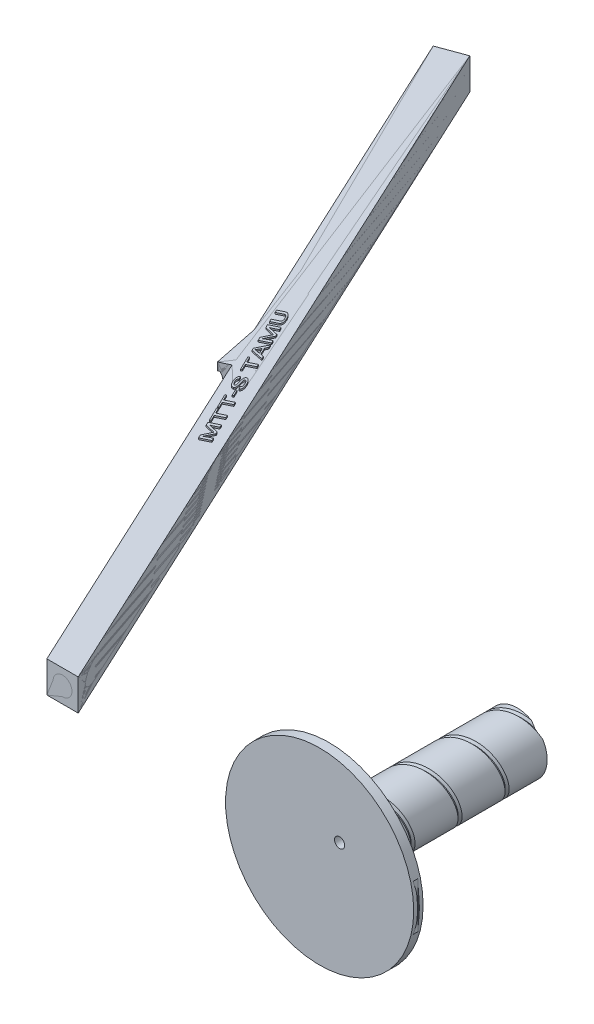
from build123d import *

# Parameters (mm, degrees)
SKETCH8_R            = 9.55
HELICALLENGTH_DEPTH  = 60
WIRETHREADS_PITCH    = 15
SKETCH12_R           = 8
CUT_EXTRUDE1_DEPTH   = 60
SKETCH14_R           = 30
TOP_OF_HELICAL_DEPTH = 3
SUPPORT_DEPTH        = 5
SKETCH18_R           = 1.616087613
SMAHOLE_DEPTH        = 3
CUT_EXTRUDE6_DEPTH   = 15
SKETCH41_R           = 4.64435048
CUT_EXTRUDE7_DEPTH   = 15
CUT_EXTRUDE8_DEPTH   = 1.5
BOSS_EXTRUDE20_DEPTH = 5
BOSS_EXTRUDE23_DEPTH = 0.5
SKETCH46_R           = 3
CUT_EXTRUDE9_DEPTH   = 10
SKETCH48_R           = 3
CUT_EXTRUDE10_DEPTH  = 10
SKETCH49_R           = 2.54
CUT_EXTRUDE11_DEPTH  = 15


with BuildPart() as part:
    # Sketch8 → HelicalLength (new body)
    with BuildSketch(Plane(origin=(0, 0, 0), x_dir=(0, 1, 0), z_dir=(0, 0, 1))):
        with Locations(Location((0, 0, 0), (0, 0, 270))):
            Circle(SKETCH8_R)
    extrude(amount=HELICALLENGTH_DEPTH)

    # WireThreads: the profile of Thread Profile1 profile screwed along a right-hand helix of 10.666667 turns, 18 arcs to a turn; built about Z, then put on its axis
    wirethreads_z = Axis((0, 0, 0), (0, 0, 1))
    wirethreads_corners = [(9.5503, -4e-09, -0.000173205), (9.5503, -4e-09, 1.312673201), (8.738101187, -4e-09, 0.843749998), (8.738101187, -4e-09, 0.468749998)]
    with BuildLine(mode=Mode.PRIVATE) as wirethreads_profile:
        Line(wirethreads_corners[0], wirethreads_corners[1])
        Line(wirethreads_corners[1], wirethreads_corners[2])
        Line(wirethreads_corners[2], wirethreads_corners[3])
        Line(wirethreads_corners[3], wirethreads_corners[0])
    wirethreads_cap = Face(wirethreads_profile.wire())
    wirethreads_turn_angles = [0, 10, 20, 30, 40, 50, 60, 70, 80, 90, 100, 110, 120, 130, 140, 150, 160, 170, 180, 190, 200, 210, 220, 230, 240, 250, 260, 270, 280, 290, 300, 310, 320, 330, 340, 350, 360]
    wirethreads_turn_weights = [1, 0.984807753012208, 1, 0.984807753012208, 1, 0.984807753012208, 1, 0.984807753012208, 1, 0.984807753012208, 1, 0.984807753012208, 1, 0.984807753012208, 1, 0.984807753012208, 1, 0.984807753012208, 1, 0.984807753012208, 1, 0.984807753012208, 1, 0.984807753012208, 1, 0.984807753012208, 1, 0.984807753012208, 1, 0.984807753012208, 1, 0.984807753012208, 1, 0.984807753012208, 1, 0.984807753012208, 1]
    wirethreads_turn_rails = [Edge.make_bspline([Vector(p[0], p[1], 0).rotate(wirethreads_z, wirethreads_turn_angles[k]) / wirethreads_turn_weights[k] + Vector(0, 0, p[2] + WIRETHREADS_PITCH * wirethreads_turn_angles[k] / 360) for k in range(37)], [0, 0, 0, 1, 1, 2, 2, 3, 3, 4, 4, 5, 5, 6, 6, 7, 7, 8, 8, 9, 9, 10, 10, 11, 11, 12, 12, 13, 13, 14, 14, 15, 15, 16, 16, 17, 17, 18, 18, 18], 2, wirethreads_turn_weights) for p in wirethreads_corners]
    wirethreads_turn_sides = [Face.make_surface_from_curves(wirethreads_turn_rails[p[0]], wirethreads_turn_rails[p[1]]) for p in [(0, 1), (1, 2), (2, 3), (3, 0)]]
    wirethreads_last_angles = [3600, 3610, 3620, 3630, 3640, 3650, 3660, 3670, 3680, 3690, 3700, 3710, 3720, 3730, 3740, 3750, 3760, 3770, 3780, 3790, 3800, 3810, 3820, 3830, 3840]
    wirethreads_last_weights = [1, 0.984807753012208, 1, 0.984807753012208, 1, 0.984807753012208, 1, 0.984807753012208, 1, 0.984807753012208, 1, 0.984807753012208, 1, 0.984807753012208, 1, 0.984807753012208, 1, 0.984807753012208, 1, 0.984807753012208, 1, 0.984807753012208, 1, 0.984807753012208, 1]
    wirethreads_last_rails = [Edge.make_bspline([Vector(p[0], p[1], 0).rotate(wirethreads_z, wirethreads_last_angles[k]) / wirethreads_last_weights[k] + Vector(0, 0, p[2] + WIRETHREADS_PITCH * wirethreads_last_angles[k] / 360) for k in range(25)], [0, 0, 0, 1, 1, 2, 2, 3, 3, 4, 4, 5, 5, 6, 6, 7, 7, 8, 8, 9, 9, 10, 10, 11, 11, 12, 12, 12], 2, wirethreads_last_weights) for p in wirethreads_corners]
    wirethreads_last_sides = [Face.make_surface_from_curves(wirethreads_last_rails[p[0]], wirethreads_last_rails[p[1]]) for p in [(0, 1), (1, 2), (2, 3), (3, 0)]]
    wirethreads = Plane(origin=(0, 0, -2), x_dir=(0.970295726, 0.241921896, 0), z_dir=(0, 0, 1)) * Solid(Shell([*[p.moved(Location((0, 0, WIRETHREADS_PITCH * i))) for i in range(10) for p in wirethreads_turn_sides], *wirethreads_last_sides, wirethreads_cap, wirethreads_cap.rotate(wirethreads_z, 3840).moved(Location((0, 0, WIRETHREADS_PITCH * 3840 / 360)))]))
    add(wirethreads, mode=Mode.SUBTRACT)

    # Sketch12 → Cut-Extrude1 (cut)
    with BuildSketch(Plane(origin=(0, 0, 0), x_dir=(0, 1, 0), z_dir=(0, 0, 1))):
        with Locations(Location((0, 0, 0), (0, 0, 270))):
            Circle(SKETCH12_R)
    extrude(amount=CUT_EXTRUDE1_DEPTH, mode=Mode.SUBTRACT)

    # Sketch14 → Top of Helical (add)
    with BuildSketch(Plane(origin=(0, 0, 60), x_dir=(0, -1, 0), z_dir=(0, 0, 1))):
        with Locations(Location((0, 0, 0), (0, 0, 90))):
            Circle(SKETCH14_R)
    extrude(amount=TOP_OF_HELICAL_DEPTH)

    # Sketch18 → SMAHole (cut)
    with BuildSketch(Plane(origin=(0, 0, 63), x_dir=(0, -1, 0), z_dir=(0, 0, 1))):
        with Locations(Location((-7.024287724, 6.37156705, 0), (0, 0, 90))):
            Circle(SKETCH18_R)
    extrude(amount=-SMAHOLE_DEPTH, mode=Mode.SUBTRACT)

    # Sketch40 → Cut-Extrude6 (cut, symmetric)
    with BuildSketch(Plane(origin=(0, 0, 0), x_dir=(-1, 0, 0), z_dir=(0, 1, 0))):
        Polygon((-30.017640083, 61.213614636), (-30.017640083, 61.797748498), (-29.709132076, 61.797748498), (-29.091337757, 62.308749648), (-29.091337757, 60.750623463), (-29.689401323, 61.213614636), align=None)
        Polygon((30.017640083, 61.213614636), (29.689401323, 61.213614636), (29.091337757, 60.750623463), (29.091337757, 62.308749648), (29.709132076, 61.797748498), (30.017640083, 61.797748498), align=None)
    extrude(amount=CUT_EXTRUDE6_DEPTH, both=True, mode=Mode.SUBTRACT)


with BuildPart() as body_2:
    # Supports → Support (new, symmetric)
    with BuildSketch(Plane(origin=(0, 0, 0), x_dir=(-1, 0, 0), z_dir=(0, 1, 0))):
        Polygon((83.08562676, 56.888083777), (192.17068586, -177.045580388), (200.710340084, -173.913858765), (93.08562676, 56.888083777), align=None)
        Polygon((144.682677547, -53.762148714), (147.861311224, -52.279927488), (150.899868695, -67.094958157), align=None)
    extrude(amount=SUPPORT_DEPTH, both=True)

    # Sketch41 → Cut-Extrude7 (cut)
    with BuildSketch(Plane(origin=(-46.433320178, 0, -99.576576464), x_dir=(0.906307787036648, 0, -0.4226182617407039), z_dir=(0.4226182617407039, 0, 0.906307787036648))):
        with Locations((-115.230535382, 0)):
            Circle(SKETCH41_R)
    extrude(amount=-CUT_EXTRUDE7_DEPTH, mode=Mode.SUBTRACT)

    # Sketch43 → Cut-Extrude8 (cut)
    # profile 1 of 9: a face of its own
    with BuildSketch(Plane(origin=(0, 5, 0), x_dir=(-1, 0, 0), z_dir=(0, 1, 0))):
        Polygon((101.908497632, 20.935164529), (104.989826782, 21.8731714), (103.215728723, 19.577733568), (106.111789192, 19.495555125), (103.42373121, 17.704658257), (103.300589447, 18.002027804), (105.20485804, 19.233003457), (102.652804739, 19.305420373), (104.205243447, 21.314061623), (102.044608508, 20.656329093), align=None)
    # profile 2 of 9: a face of its own
    with BuildSketch(Plane(origin=(0, 5, 0), x_dir=(-1, 0, 0), z_dir=(0, 1, 0))):
        Polygon((104.010737658, 16.513973337), (106.572656969, 17.731496921), (106.881829893, 17.080933684), (107.16025689, 17.213253009), (106.416931243, 18.77736261), (106.141935363, 18.646673885), (106.440860272, 18.017674572), (103.875509845, 16.798520388), align=None)
    # profile 3 of 9: a face of its own
    with BuildSketch(Plane(origin=(0, 5, 0), x_dir=(-1, 0, 0), z_dir=(0, 1, 0))):
        Polygon((106.94552295, 16.965484662), (107.249966409, 16.324873188), (104.680846232, 15.103927472), (104.825356028, 14.799849226), (107.388352808, 16.017884866), (107.684443475, 15.39484938), (107.959269871, 15.52545756), (107.214936987, 17.091686597), align=None)
    # profile 4 of 9: a face of its own
    with BuildSketch(Plane(origin=(0, 5, 0), x_dir=(-1, 0, 0), z_dir=(0, 1, 0))):
        with BuildLine():
            Line((106.572656969, 12.803191771), (106.30250258, 12.988551078))
            add(Edge.make_bspline(
                [(106.30250258, 12.988551078), (106.190108618, 12.78649648), (105.961578122, 12.460162512), (106.039057842, 11.913531496), (106.289719043, 11.51527126), (106.821583218, 11.234848843), (107.463168036, 11.422068411), (107.798028902, 11.99579714), (107.901924956, 12.576763377), (107.972014339, 13.14557376), (108.427571046, 13.445302534), (108.977535116, 13.130130643), (108.843254764, 12.613851755), (108.722433741, 12.415092605)],
                knots=[0, 0, 0, 0, 0.118699951, 0.173525631, 0.259900002, 0.338135732, 0.45055753, 0.543452667, 0.645861308, 0.740559264, 0.809818857, 0.869875766, 1, 1, 1, 1], degree=3))
            Line((108.722433741, 12.415092605), (109.000113213, 12.274926265))
            add(Edge.make_bspline(
                [(109.000113213, 12.274926265), (109.307540104, 12.593589805), (109.265655626, 13.574940753), (108.115096471, 13.79157408), (107.613267108, 13.093782117), (107.535406166, 12.410267169), (107.28833549, 11.528074425), (106.462401361, 11.688478705), (106.26087006, 12.270558064), (106.428292622, 12.618028788), (106.572656969, 12.803191771)],
                knots=[0, 0, 0, 0, 0.216001481, 0.35012049, 0.454375998, 0.593459615, 0.711588445, 0.832522221, 0.880344774, 1, 1, 1, 1], degree=3))
        make_face()
    # profile 5 of 9: a face of its own
    with BuildSketch(Plane(origin=(0, 5, 0), x_dir=(-1, 0, 0), z_dir=(0, 1, 0))):
        Polygon((109.795683577, 10.836796161), (110.100127036, 10.196184687), (107.531006859, 8.975238971), (107.675516655, 8.671160724), (110.238513435, 9.889196364), (110.534604102, 9.266160878), (110.809430498, 9.396769058), (110.065097614, 10.962998095), align=None)
    # profile 6 of 9: a face of its own
    with BuildSketch(Plane(origin=(0, 5, 0), x_dir=(-1, 0, 0), z_dir=(0, 1, 0))):
        Polygon((109.467817375, 4.777235387), (112.549146525, 5.715242258), (110.775048466, 3.419804426), (113.671108935, 3.337625983), (110.983050953, 1.546729114), (110.859909189, 1.844098662), (112.764177783, 3.075074315), (110.212124482, 3.147491231), (111.76456319, 5.156132481), (109.603928251, 4.498399951), align=None)
    # profile 7 of 9: a face of its own
    with BuildSketch(Plane(origin=(0, 5, 0), x_dir=(-1, 0, 0), z_dir=(0, 1, 0))):
        Polygon((108.203081718, 7.592107239), (109.335423422, 7.592107239), (109.910063456, 6.359858071), (109.179335354, 5.460201065), (109.335423422, 5.125488234), (111.617648658, 7.890356698), (108.075544448, 7.890356698), align=None)
        Polygon((109.677802838, 7.592107239), (110.951395884, 7.592107239), (110.142324073, 6.595995112), align=None, mode=Mode.SUBTRACT)
    # profile 8 of 9: a face of its own
    with BuildSketch(Plane(origin=(0, 5, 0), x_dir=(-1, 0, 0), z_dir=(0, 1, 0))):
        with BuildLine():
            Line((114.127320437, 2.393199278), (114.258091162, 2.108115944))
            add(Edge.make_bspline(
                [(114.258091162, 2.108115944), (113.715042873, 1.887999836), (113.048651015, 1.478845281), (112.091238625, 1.16446245), (111.730231436, 0.563045696), (112.014321582, -0.130160643), (112.720485008, -0.28753468), (113.259075546, -0.003127015), (113.971480872, 0.353536158), (114.530338049, 0.587478058), (114.893287009, 0.789173222)],
                knots=[0, 0, 0, 0, 0.260538378, 0.357169988, 0.440729027, 0.545307052, 0.639288111, 0.729164541, 0.812847814, 1, 1, 1, 1], degree=3))
            Line((114.893287009, 0.789173222), (115.008888857, 0.473660029))
            add(Edge.make_bspline(
                [(111.997113723, 1.373226328), (111.741538192, 1.248275607), (111.456769555, 0.743431722), (111.59181229, -0.027539668), (112.074568318, -0.513563723), (112.734522828, -0.602950171), (113.300122533, -0.282905981), (114.098932523, -0.006758416), (114.607854852, 0.370013532), (115.008888857, 0.473660029)],
                knots=[0, 0, 0, 0, 0.154629891, 0.301164492, 0.410595199, 0.52121942, 0.649695503, 0.769001732, 1, 1, 1, 1], degree=3))
            Line((111.997113723, 1.373226328), (114.127320437, 2.393199278))
        make_face()
    # profile 9 of 9: a face of its own
    with BuildSketch(Plane(origin=(0, 5, 0), x_dir=(-1, 0, 0), z_dir=(0, 1, 0))):
        Polygon((106.377564414, 14.547426773), (106.881829893, 13.474094038), (106.645198383, 13.362921521), (106.134555169, 14.433257914), align=None)
    extrude(amount=-CUT_EXTRUDE8_DEPTH, mode=Mode.SUBTRACT)


with BuildPart() as body_3:
    # Supports<3> → Boss-Extrude20 (new, symmetric)
    with BuildSketch(Plane(origin=(0, 0, 0), x_dir=(-1, 0, 0), z_dir=(0, 1, 0))):
        Polygon((83.08562676, 56.888083777), (192.17068586, -177.045580388), (200.710340084, -173.913858765), (93.08562676, 56.888083777), align=None)
        Polygon((144.682677547, -53.762148714), (147.861311224, -52.279927488), (150.899868695, -67.094958157), align=None)
    extrude(amount=BOSS_EXTRUDE20_DEPTH, both=True)

    # Sketch42 → Boss-Extrude23 (add)
    # profile 1 of 9: a face of its own
    with BuildSketch(Plane(origin=(0, 5, 0), x_dir=(-1, 0, 0), z_dir=(0, 1, 0))):
        Polygon((129.928272395, -28.8679929), (128.527612898, -31.81491863), (131.701968621, -32.535865262), (132.224477752, -33.615674515), (129.338114116, -35.0195554), (128.913535179, -34.142049312), (130.048752306, -33.589903411), (131.218116145, -33.107983768), (128.084994189, -32.428270903), (127.771230999, -31.78012764), (129.180266104, -28.907938111), (128.065021583, -29.543195822), (126.951709895, -30.084389004), (126.527130958, -29.206882916), (129.413494595, -27.803002031), align=None)
    # profile 2 of 9: a face of its own
    with BuildSketch(Plane(origin=(0, 5, 0), x_dir=(-1, 0, 0), z_dir=(0, 1, 0))):
        Polygon((134.427730056, -39.198613918), (133.539271249, -37.36113421), (131.024011509, -38.584617367), (130.601365405, -37.710976945), (133.116625145, -36.487493788), (132.230743449, -34.654524023), (132.601847345, -34.474126296), (134.798833952, -39.01821619), align=None)
    # profile 3 of 9: a face of its own
    with BuildSketch(Plane(origin=(0, 5, 0), x_dir=(-1, 0, 0), z_dir=(0, 1, 0))):
        Polygon((136.776080691, -44.10880161), (135.887621885, -42.271321902), (133.372362144, -43.494805059), (132.94971604, -42.621164637), (135.464975781, -41.39768148), (134.579094084, -39.564711715), (134.95019798, -39.384313988), (137.147184587, -43.928403882), align=None)
    # profile 4 of 9: a face of its own
    with BuildSketch(Plane(origin=(0, 5, 0), x_dir=(-1, 0, 0), z_dir=(0, 1, 0))):
        Polygon((136.447457909, -47.16926832), (135.461068908, -45.129485446), (135.832172804, -44.949087719), (136.818561806, -46.988870592), align=None)
    # profile 5 of 9: a face of its own
    with BuildSketch(Plane(origin=(0, 5, 0), x_dir=(-1, 0, 0), z_dir=(0, 1, 0))):
        with BuildLine():
            add(Edge.make_bspline(
                [(137.826866176, -49.592827122), (137.800251507, -49.508551992), (137.748743648, -49.345452776), (137.680895792, -49.107243573), (137.621645899, -48.884424583), (137.572629872, -48.676935901), (137.533401354, -48.484493198), (137.50500149, -48.307349678), (137.48569225, -48.145538849), (137.476684692, -47.998356884), (137.478463081, -47.864835529), (137.489140697, -47.7439069), (137.511321963, -47.635153343), (137.544788536, -47.539191538), (137.587882628, -47.454834778), (137.642883692, -47.383768475), (137.707770866, -47.323866232), (137.758759849, -47.295857112), (137.784343855, -47.28180338)],
                knots=[0, 0, 0, 0, 1.723105539, 3.334757956, 4.828809269, 6.218264627, 7.491141696, 8.657314145, 9.715335221, 10.6674251, 11.53011427, 12.316771186, 13.031254377, 13.688124087, 14.293093634, 14.869324698, 15.432677378, 16, 16, 16, 16], degree=3))
            add(Edge.make_bspline(
                [(137.784343855, -47.28180338), (137.799479472, -47.275079322), (137.829457432, -47.261761494), (137.876237164, -47.246804357), (137.923987645, -47.2370968), (137.97280036, -47.232773849), (138.022642644, -47.232588272), (138.073518624, -47.237995626), (138.125378968, -47.247883723), (138.178434668, -47.26171407), (138.231930923, -47.282351931), (138.286761923, -47.306878138), (138.34293293, -47.335729677), (138.399559071, -47.37033882), (138.457762216, -47.409002457), (138.516981777, -47.452761455), (138.576740152, -47.502070972), (138.659435645, -47.57414834), (138.762365296, -47.67410133), (138.882007424, -47.806743415), (138.999955369, -47.951821821), (139.115403235, -48.110111109), (139.228053214, -48.281956473), (139.338499889, -48.46704461), (139.447932143, -48.664833887), (139.516083403, -48.80307976), (139.550953027, -48.873813323)],
                knots=[0, 0, 0, 0, 0.464470509, 0.919941247, 1.374933382, 1.828846814, 2.292848003, 2.771335852, 3.26181586, 3.773422011, 4.307326038, 4.868390641, 5.45863008, 6.077666695, 6.729477116, 7.418867167, 8.142613338, 8.90279615, 10.496621951, 12.164645879, 13.912328274, 15.740756874, 17.659455011, 19.675713627, 21.787476908, 24, 24, 24, 24], degree=3))
            add(Edge.make_bspline(
                [(139.550953027, -48.873813323), (139.574661156, -48.923499803), (139.621481044, -49.021622914), (139.685678296, -49.169431004), (139.745008825, -49.315058879), (139.799406339, -49.458333875), (139.846958015, -49.599918204), (139.889574446, -49.739113819), (139.927176261, -49.876309386), (139.95856624, -50.011101866), (139.984293574, -50.142196494), (140.004576584, -50.268499843), (140.018263355, -50.389752559), (140.025351487, -50.505883102), (140.026723706, -50.617047608), (140.02264978, -50.723155549), (140.011469023, -50.824041152), (139.995274937, -50.919369089), (139.971959785, -51.008293858), (139.943432465, -51.090877556), (139.907164516, -51.165666639), (139.865137167, -51.233519122), (139.816491354, -51.293958689), (139.761495587, -51.346915902), (139.700276644, -51.39314884), (139.655052424, -51.416953606), (139.632132004, -51.429018275)],
                knots=[0, 0, 0, 0, 1.428638541, 2.821340149, 4.181304635, 5.509432741, 6.79781337, 8.056620887, 9.286988033, 10.488849188, 11.647480965, 12.753453813, 13.80777677, 14.812867108, 15.771563201, 16.692007623, 17.566611245, 18.404111834, 19.198986447, 19.949933501, 20.667847665, 21.351383846, 22.017263889, 22.675519681, 23.328730386, 24, 24, 24, 24], degree=3))
            Line((139.632132004, -51.429018275), (139.205620234, -50.547646521))
            add(Edge.make_bspline(
                [(139.205620234, -50.547646521), (139.227824819, -50.535977911), (139.271290741, -50.513136371), (139.326934738, -50.465884929), (139.375172712, -50.412717252), (139.413135883, -50.350674801), (139.442341267, -50.281134532), (139.462985684, -50.204226361), (139.473266339, -50.119305824), (139.475806333, -50.027191452), (139.468758344, -49.927885839), (139.453898486, -49.821932248), (139.429585877, -49.709456481), (139.396556536, -49.5906189), (139.354987977, -49.46537888), (139.305119091, -49.333630037), (139.246643742, -49.195439864), (139.202527234, -49.102161051), (139.17984913, -49.054211051)],
                knots=[0, 0, 0, 0, 0.729458673, 1.427930046, 2.11553401, 2.815940248, 3.537178797, 4.308967099, 5.130105002, 6.026081603, 6.99263356, 8.029837389, 9.143986566, 10.345885826, 11.625341937, 12.991003918, 14.453224691, 16, 16, 16, 16], degree=3))
            add(Edge.make_bspline(
                [(139.17984913, -49.054211051), (139.158576178, -49.011371848), (139.117261404, -48.928172681), (139.0539017, -48.808977911), (138.989802271, -48.699742823), (138.926328895, -48.599772429), (138.862589046, -48.509369534), (138.798906999, -48.428527637), (138.73516073, -48.357544968), (138.672054393, -48.295963877), (138.609750954, -48.244190067), (138.548439964, -48.202332027), (138.488037968, -48.171081758), (138.429165778, -48.148906292), (138.370854049, -48.138304484), (138.314221979, -48.138460626), (138.258372679, -48.147655269), (138.223926914, -48.16262274), (138.206345681, -48.170262187)],
                knots=[0, 0, 0, 0, 1.604295978, 3.115746355, 4.526625776, 5.851469342, 7.086621125, 8.235246218, 9.301280697, 10.284462993, 11.190177822, 12.015308523, 12.769194773, 13.466477768, 14.117860554, 14.744558875, 15.359218652, 16, 16, 16, 16], degree=3))
            add(Edge.make_bspline(
                [(138.206345681, -48.170262187), (138.193069086, -48.177652851), (138.166205577, -48.192606925), (138.132689861, -48.225689969), (138.105261567, -48.266151761), (138.083176822, -48.313974476), (138.067541868, -48.369658003), (138.057629692, -48.432790577), (138.052386479, -48.503262449), (138.054165518, -48.582343549), (138.06251584, -48.67199083), (138.07672694, -48.774140053), (138.098425981, -48.889695447), (138.126978041, -49.018564022), (138.162560962, -49.160961447), (138.205430556, -49.316749826), (138.254224088, -49.486329167), (138.30951956, -49.66509266), (138.366351011, -49.846061213), (138.418500441, -50.022414542), (138.465132011, -50.190165675), (138.509026188, -50.348307422), (138.546068395, -50.498214566), (138.579237042, -50.638998052), (138.606933013, -50.771374345), (138.630225199, -50.895297247), (138.649530306, -51.011848121), (138.662622031, -51.122187192), (138.672934392, -51.22653699), (138.677285829, -51.32524141), (138.677519739, -51.417907493), (138.673084956, -51.504806607), (138.664271085, -51.585957746), (138.65079993, -51.661533824), (138.633120893, -51.73155102), (138.609792995, -51.795232509), (138.582707177, -51.853544425), (138.550499461, -51.90604942), (138.512899658, -51.952684581), (138.470713828, -51.993557475), (138.424112379, -52.02897196), (138.389808319, -52.047322734), (138.372569301, -52.056544654)],
                knots=[0, 0, 0, 0, 0.440684716, 0.891669754, 1.354670622, 1.858111505, 2.418007999, 3.032610635, 3.715871532, 4.472422477, 5.332175479, 6.335655114, 7.473555403, 8.753782431, 10.177536137, 11.74568702, 13.457139408, 15.314042859, 17.192552015, 18.97878049, 20.66705716, 22.260978448, 23.755994805, 25.161736776, 26.471211456, 27.692442042, 28.832246969, 29.909307398, 30.926404125, 31.883904562, 32.784139745, 33.623000839, 34.41555409, 35.158683708, 35.856182211, 36.514743627, 37.12998184, 37.725070337, 38.303067553, 38.868969866, 39.431616856, 40, 40, 40, 40], degree=3))
            add(Edge.make_bspline(
                [(138.372569301, -52.056544654), (138.357884006, -52.063123231), (138.328859595, -52.076125307), (138.28311082, -52.089429188), (138.236782457, -52.098694127), (138.189019438, -52.102502391), (138.140412144, -52.101270811), (138.090683293, -52.094331657), (138.039918793, -52.083654422), (137.988055865, -52.067179877), (137.935097029, -52.0458121), (137.88123187, -52.019243729), (137.825927194, -51.988214068), (137.770277478, -51.951399902), (137.71350239, -51.909620328), (137.654520779, -51.864558688), (137.596334494, -51.812073002), (137.514035054, -51.736781728), (137.412424792, -51.630869167), (137.29327914, -51.490812439), (137.173929462, -51.33779391), (137.05687566, -51.169358777), (136.940171844, -50.987352767), (136.826132862, -50.789941366), (136.710613332, -50.57969678), (136.638436656, -50.432414303), (136.601450186, -50.356940352)],
                knots=[0, 0, 0, 0, 0.438676977, 0.867012979, 1.296909992, 1.726207287, 2.171799106, 2.621076103, 3.094695936, 3.585939025, 4.104001579, 4.651842486, 5.223975426, 5.833577981, 6.471326033, 7.147810773, 7.857962436, 8.608653778, 10.191997554, 11.858847655, 13.625622324, 15.485737225, 17.454639094, 19.524409571, 21.706512696, 24, 24, 24, 24], degree=3))
            add(Edge.make_bspline(
                [(136.601450186, -50.356940352), (136.555784881, -50.258803684), (136.465779007, -50.065377258), (136.349929873, -49.772037118), (136.253068297, -49.481658054), (136.187151482, -49.241734584), (136.14574825, -49.054006173), (136.120217825, -48.920016884), (136.101610883, -48.791440631), (136.088420822, -48.668747146), (136.081838065, -48.55176642), (136.08160312, -48.440542381), (136.088123996, -48.335136924), (136.099859315, -48.235554318), (136.118890812, -48.14246403), (136.145827099, -48.056431511), (136.180572898, -47.977406774), (136.224320241, -47.906603121), (136.273830996, -47.841607144), (136.332567936, -47.785422059), (136.398804454, -47.736324811), (136.447736122, -47.710488128), (136.472594666, -47.69736243)],
                knots=[0, 0, 0, 0, 2.247524343, 4.429848797, 6.545411151, 8.602171079, 9.593384728, 10.537230121, 11.434144288, 12.290661146, 13.099151716, 13.866271208, 14.599069217, 15.291116484, 15.947145513, 16.569199194, 17.160161426, 17.734601427, 18.29397112, 18.852255159, 19.416916149, 20, 20, 20, 20], degree=3))
            Line((136.472594666, -47.69736243), (136.898462158, -48.578734184))
            add(Edge.make_bspline(
                [(136.898462158, -48.578734184), (136.875635787, -48.591066815), (136.831041581, -48.615160172), (136.77326403, -48.66391653), (136.726244707, -48.721899253), (136.688535343, -48.788193433), (136.661373819, -48.86357386), (136.645108858, -48.947635326), (136.638428123, -49.040139866), (136.641282718, -49.14089161), (136.654336916, -49.248601611), (136.674027113, -49.363200847), (136.70387665, -49.483564155), (136.740148717, -49.610679122), (136.786756462, -49.743317202), (136.839980563, -49.88283567), (136.902692838, -50.028070808), (136.94886738, -50.126202731), (136.972554082, -50.176542625)],
                knots=[0, 0, 0, 0, 0.709090734, 1.385298482, 2.053996579, 2.744077219, 3.464107473, 4.238035802, 5.081528953, 5.999294463, 6.993631265, 8.050444972, 9.181620657, 10.387735671, 11.669198607, 13.030091282, 14.476490764, 16, 16, 16, 16], degree=3))
            add(Edge.make_bspline(
                [(136.972554082, -50.176542625), (136.995895015, -50.224147102), (137.041104908, -50.316353926), (137.111349504, -50.447872163), (137.180936464, -50.568303782), (137.249093836, -50.67851999), (137.31725204, -50.777480811), (137.384143381, -50.865996991), (137.449930955, -50.944095856), (137.515325281, -51.010944387), (137.579252464, -51.067122238), (137.640275177, -51.113800586), (137.700035175, -51.148661082), (137.756535205, -51.174649897), (137.811208991, -51.189489352), (137.863692422, -51.193667565), (137.914093652, -51.187406742), (137.960965402, -51.170006907), (138.00391506, -51.14471163), (138.039319271, -51.109314551), (138.070163678, -51.068194668), (138.092094459, -51.018263403), (138.108341119, -50.961279177), (138.117446063, -50.896936361), (138.12043499, -50.825117828), (138.116938583, -50.744747709), (138.105710203, -50.65277294), (138.08837127, -50.546747778), (138.062476197, -50.425320562), (138.030510979, -50.288369297), (137.990186903, -50.136152736), (137.942247168, -49.968755501), (137.887512551, -49.785755206), (137.847643376, -49.658923494), (137.826866176, -49.592827122)],
                knots=[0, 0, 0, 0, 1.604772781, 3.10834217, 4.512142819, 5.814487094, 7.029818658, 8.147954446, 9.171765048, 10.118724648, 10.975483638, 11.746465335, 12.43993887, 13.06566094, 13.623849432, 14.145364401, 14.6501203, 15.147751463, 15.649442227, 16.145968203, 16.653062881, 17.196987605, 17.785433776, 18.442774319, 19.158587407, 19.958831363, 20.874850704, 21.961728563, 23.209875974, 24.632158711, 26.218377816, 27.97567877, 29.902787667, 32, 32, 32, 32], degree=3))
        make_face()
    # profile 6 of 9: a face of its own
    with BuildSketch(Plane(origin=(0, 5, 0), x_dir=(-1, 0, 0), z_dir=(0, 1, 0))):
        Polygon((143.536484035, -58.24419042), (142.648025229, -56.406710712), (140.132765488, -57.63019387), (139.710119384, -56.756553448), (142.225379125, -55.53307029), (141.339497428, -53.700100526), (141.710601324, -53.519702798), (143.907587932, -58.063792693), align=None)
    # profile 7 of 9: a face of its own
    with BuildSketch(Plane(origin=(0, 5, 0), x_dir=(-1, 0, 0), z_dir=(0, 1, 0))):
        Polygon((143.675606789, -63.115721456), (142.553919492, -60.795677828), (141.552067828, -60.618501489), (141.130066002, -59.7467939), (145.082064784, -60.546342398), (145.436417463, -61.278886026), (143.622131749, -64.899726124), (143.197552812, -64.022220036), align=None)
        Polygon((143.049368965, -60.871702585), (143.929452163, -62.691786797), (144.720625052, -61.175157333), align=None, mode=Mode.SUBTRACT)
    # profile 8 of 9: a face of its own
    with BuildSketch(Plane(origin=(0, 5, 0), x_dir=(-1, 0, 0), z_dir=(0, 1, 0))):
        Polygon((147.362996809, -65.322416674), (145.962337312, -68.269342404), (149.136693034, -68.990289036), (149.659202166, -70.070098289), (146.772838529, -71.473979174), (146.348259593, -70.596473086), (147.483476719, -70.044327185), (148.652840559, -69.562407542), (145.519718602, -68.882694677), (145.205955413, -68.234551414), (146.614990518, -65.362361885), (145.499745997, -65.997619596), (144.386434309, -66.538812778), (143.961855372, -65.66130669), (146.848219008, -64.257425805), align=None)
    # profile 9 of 9: a face of its own
    with BuildSketch(Plane(origin=(0, 5, 0), x_dir=(-1, 0, 0), z_dir=(0, 1, 0))):
        with BuildLine():
            Line((152.265127968, -75.53835628), (150.314899681, -76.486088625))
            add(Edge.make_bspline(
                [(150.314899681, -76.486088625), (150.280292454, -76.500396635), (150.211640701, -76.52878001), (150.101308246, -76.550025834), (149.987925718, -76.551351437), (149.871121761, -76.535108517), (149.751870996, -76.498286801), (149.629330512, -76.44419102), (149.503962982, -76.370834559), (149.375916283, -76.280082954), (149.247087211, -76.172614264), (149.119422304, -76.049714305), (148.993600442, -75.911770808), (148.86962721, -75.759170137), (148.747555096, -75.591449317), (148.627731002, -75.408905484), (148.507672835, -75.212503783), (148.433162952, -75.073993233), (148.394952441, -75.002961596)],
                knots=[0, 0, 0, 0, 0.680940019, 1.350808211, 2.031692027, 2.738834952, 3.49021657, 4.297851306, 5.174296069, 6.131718823, 7.154158697, 8.227822335, 9.357687515, 10.553531449, 11.808000652, 13.135143382, 14.530830653, 16, 16, 16, 16], degree=3))
            Line((148.394952441, -75.002961596), (148.29315658, -74.802591263))
            add(Edge.make_bspline(
                [(148.29315658, -74.802591263), (148.256668526, -74.725127168), (148.18547106, -74.57397503), (148.091784476, -74.34832638), (148.010233159, -74.130982734), (147.944296784, -73.920842775), (147.889857033, -73.719045836), (147.850505729, -73.524906916), (147.824330144, -73.338610502), (147.813360254, -73.188402538), (147.812754473, -73.073125385), (147.814706273, -72.99137237), (147.822279142, -72.913166281), (147.832172459, -72.838459565), (147.846359922, -72.767439432), (147.864380574, -72.700045606), (147.886403243, -72.636451474), (147.911131769, -72.575950483), (147.94133684, -72.519972929), (147.973863468, -72.466807391), (148.010967603, -72.417605471), (148.051510035, -72.37198765), (148.095484499, -72.329435672), (148.144194508, -72.291909036), (148.195617901, -72.256454364), (148.23260051, -72.236730795), (148.251278536, -72.226769429)],
                knots=[0, 0, 0, 0, 2.188939794, 4.271177846, 6.244727004, 8.121908076, 9.899890899, 11.586184828, 13.182682068, 14.707176346, 15.431967976, 16.129631152, 16.79674411, 17.439694077, 18.055630847, 18.646996056, 19.221737622, 19.775453851, 20.315805633, 20.84601964, 21.367635012, 21.888816728, 22.405320947, 22.929271857, 23.459229934, 24, 24, 24, 24], degree=3))
            Line((148.251278536, -72.226769429), (150.204728212, -71.276459973))
            Line((150.204728212, -71.276459973), (150.624797205, -72.146234729))
            Line((150.624797205, -72.146234729), (148.672636085, -73.095899908))
            add(Edge.make_bspline(
                [(148.672636085, -73.095899908), (148.649199536, -73.108268852), (148.603415421, -73.132432016), (148.543187335, -73.180759769), (148.492082821, -73.236466341), (148.449370435, -73.299664156), (148.417441197, -73.371138481), (148.393093541, -73.449792419), (148.379907735, -73.536559007), (148.373815086, -73.630376537), (148.378389099, -73.731294673), (148.391483173, -73.838929702), (148.413620401, -73.953464818), (148.445651588, -74.074416093), (148.48624762, -74.202239237), (148.537143622, -74.336296149), (148.596313827, -74.477551731), (148.641133333, -74.572961501), (148.664260476, -74.622193536)],
                knots=[0, 0, 0, 0, 0.751812708, 1.468692337, 2.181506454, 2.894242161, 3.626242723, 4.398589855, 5.227480675, 6.114268739, 7.067201936, 8.093859638, 9.194025861, 10.379921813, 11.648224714, 13.004199612, 14.454148374, 16, 16, 16, 16], degree=3))
            add(Edge.make_bspline(
                [(148.664260476, -74.622193536), (148.689484787, -74.672832901), (148.738408448, -74.771050176), (148.814948217, -74.910973184), (148.892067911, -75.038848989), (148.97018697, -75.154343082), (149.047851303, -75.258311632), (149.125741501, -75.350414693), (149.204565513, -75.43015794), (149.283587786, -75.497942619), (149.362315815, -75.554023953), (149.440625853, -75.597535106), (149.51772503, -75.629674418), (149.593704059, -75.650275206), (149.668792642, -75.658401554), (149.742675249, -75.653452247), (149.815893296, -75.637831228), (149.861831384, -75.617580653), (149.885166523, -75.607293983)],
                knots=[0, 0, 0, 0, 1.572147782, 3.049249787, 4.431084316, 5.720616449, 6.922651472, 8.036120806, 9.070100822, 10.035321242, 10.926192679, 11.751688589, 12.519781632, 13.242179165, 13.932271022, 14.607992269, 15.292902794, 16, 16, 16, 16], degree=3))
            Line((149.885166523, -75.607293983), (151.839260476, -74.656984526))
            Line((151.839260476, -74.656984526), (152.265127968, -75.53835628))
        make_face()
    extrude(amount=BOSS_EXTRUDE23_DEPTH)

    # Sketch46 → Cut-Extrude9 (cut)
    with BuildSketch(Plane.XY.offset(56.888083777)):
        with Locations((-88.08562676, 0)):
            Circle(SKETCH46_R)
    extrude(amount=-CUT_EXTRUDE9_DEPTH, mode=Mode.SUBTRACT)

    # Sketch48 → Cut-Extrude10 (cut)
    with BuildSketch(Plane(origin=(-80.011528396, 0, -218.177369735), x_dir=(0.9388580117583986, 0, -0.34430456540259075), z_dir=(-0.34430456540259075, 0, -0.9388580117583986))):
        with Locations(Location((-124.011280852, 0, 0), (0, 0, 180))):
            Circle(SKETCH48_R)
    extrude(amount=-CUT_EXTRUDE10_DEPTH, mode=Mode.SUBTRACT)

    # Sketch49 → Cut-Extrude11 (cut)
    with BuildSketch(Plane(origin=(-46.433320178, 0, -99.576576464), x_dir=(0.9063077870366485, 0, -0.4226182617407028), z_dir=(0.4226182617407028, 0, 0.9063077870366485))):
        with Locations((-111.471551534, 0)):
            Circle(SKETCH49_R)
    extrude(amount=-CUT_EXTRUDE11_DEPTH, mode=Mode.SUBTRACT)


solid = Compound([part.part, body_2.part, body_3.part])
